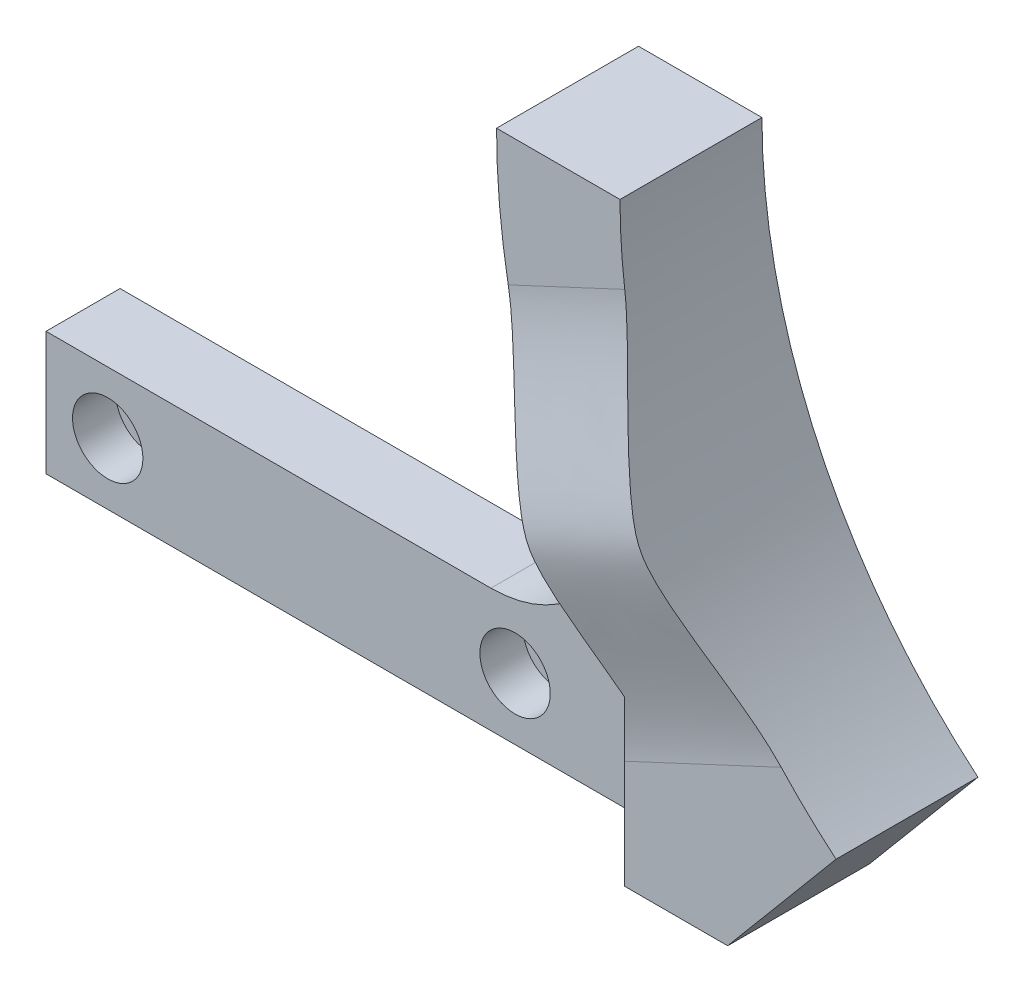
from build123d import *

# Parameters (mm, degrees)
BOSS_EXTRUDE1_DEPTH = 16
SKETCH1_3_W         = 10
SKETCH1_3_H         = 55.866863614
SKETCH1_3_R         = 2.85
BOSS_EXTRUDE2_DEPTH = 6
SKETCH1_4_R         = 2.85
SKETCH1_4_R_2       = 1.6
BOSS_EXTRUDE3_DEPTH = 2.5
CHAMFER3_SIZE       = 10.645574538
CHAMFER4_SIZE       = 9
CUT_EXTRUDE2_DEPTH  = 27.5
FILLET1_R           = 10


with BuildPart() as part:
    # Sketch1 → Boss-Extrude1 (new body)
    with BuildSketch(Plane(origin=(0, 0, 0), x_dir=(0, 1, 0), z_dir=(0, 0, 1))):
        with BuildLine():
            Line((-40.217333264, 33.746349509), (-37.536177713, 31.496592875))
            ThreePointArc((-37.536177713, 31.496592875), (-20.708294825, 44.409081565), (0, 49))
            Line((0, 49), (0, 52.5))
            Line((0, 52.5), (0, 59))
            ThreePointArc((0, 59), (-20.225540206, 55.42497202), (-38, 45.133136386))
            Line((-38, 45.133136386), (-48, 45.133136386))
            Line((-48, 45.133136386), (-48, 40.276782297))
            Line((-48, 40.276782297), (-40.217333264, 33.746349509))
        make_face()
    extrude(amount=BOSS_EXTRUDE1_DEPTH)

    # Sketch1<3> → Boss-Extrude2 (add)
    with BuildSketch(Plane(origin=(0, 0, 0), x_dir=(0, 1, 0), z_dir=(0, 0, 1))):
        with Locations((-43, 73.066568193)):
            Rectangle(SKETCH1_3_W, SKETCH1_3_H)
        with Locations(Location((-43, 96, 0), (0, 0, 270))):
            Circle(SKETCH1_3_R, mode=Mode.SUBTRACT)
        with Locations(Location((-43, 63, 0), (0, 0, 270))):
            Circle(SKETCH1_3_R, mode=Mode.SUBTRACT)
    extrude(amount=BOSS_EXTRUDE2_DEPTH)

    # Sketch1<4> → Boss-Extrude3 (add)
    # profile 1 of 2: a face of its own
    with BuildSketch(Plane(origin=(0, 0, 0), x_dir=(0, 1, 0), z_dir=(0, 0, 1))):
        with Locations(Location((-43, 96, 0), (0, 0, 270))):
            Circle(SKETCH1_4_R)
        with Locations(Location((-43, 96, 0), (0, 0, 270))):
            Circle(SKETCH1_4_R_2, mode=Mode.SUBTRACT)
    # profile 2 of 2: a face of its own
    with BuildSketch(Plane(origin=(0, 0, 0), x_dir=(0, 1, 0), z_dir=(0, 0, 1))):
        with Locations(Location((-43, 63, 0), (0, 0, 270))):
            Circle(SKETCH1_4_R)
        with Locations(Location((-43, 63, 0), (0, 0, 270))):
            Circle(SKETCH1_4_R_2, mode=Mode.SUBTRACT)
    extrude(amount=BOSS_EXTRUDE3_DEPTH)

    # Chamfer3
    # the kernel refuses this chamfer: 15, 10.645574538 mm, written as the material it adds along each edge
    with BuildSketch(Plane(origin=(-45.133136386, -38, 0), x_dir=(-0.520323475299402, 0.8539692506480269, 0), z_dir=(0, 0, 1))) as chamfer3_piece_1_section:
        with BuildLine():
            Line((17.934002299, 0), (CHAMFER3_SIZE * 0.520323475317, CHAMFER3_SIZE * 0.853969250677))
            Line((CHAMFER3_SIZE * 0.520323475317, CHAMFER3_SIZE * 0.853969250677), (0, 0))
            ThreePointArc((0, 0), (9.212497423, 0.684886528), (17.934002299, 0))
        make_face()
    chamfer3_piece_1 = extrude(amount=6, mode=Mode.PRIVATE)
    chamfer3_piece_1 = split(chamfer3_piece_1, bisect_by=Plane(origin=(-45.133136386, -38, 0), z_dir=(-1, 0, 0)), keep=Keep.TOP, mode=Mode.PRIVATE)
    add(chamfer3_piece_1)

    # Chamfer4
    chamfer4_edges = [part.edges().sort_by_distance(p)[0] for p in [
        (-45.133136386, -43, 6),
    ]]
    chamfer(chamfer4_edges, length=CHAMFER4_SIZE)

    # Sketch3 → Cut-Extrude2 (cut)
    with BuildSketch(Plane(origin=(-40.248296437, -18.768088856, 0), x_dir=(0, 0, -1), z_dir=(0.9063077870366554, 0.42261826174068795, 0))):
        with BuildLine():
            Line((-11.5, -15), (-11.5, -26.481070055))
            Line((-11.5, -26.481070055), (-21.940266499, -26.481070055))
            Line((-21.940266499, -26.481070055), (-21.940266499, 24.934477443))
            Line((-21.940266499, 24.934477443), (-11.5, 24.934477443))
            Line((-11.5, 24.934477443), (-11.5, 15))
            add(Edge.make_bspline(
                [(-11.5, -15), (-11.5, -10.5), (-14.436309762, -3.235504373), (-14.602449576, 2.674959083), (-11.5, 10.5), (-11.5, 15)],
                knots=[0, 0, 0, 0, 0.483457159, 0.583457159, 1, 1, 1, 1], degree=3))
        make_face()
    extrude(amount=-CUT_EXTRUDE2_DEPTH, mode=Mode.SUBTRACT)

    # Fillet1
    fillet1_edges = [part.edges().sort_by_distance(p)[0] for p in [
        (-55.778710924, -38, 3),
    ]]
    fillet(fillet1_edges, radius=FILLET1_R)


solid = part.part
